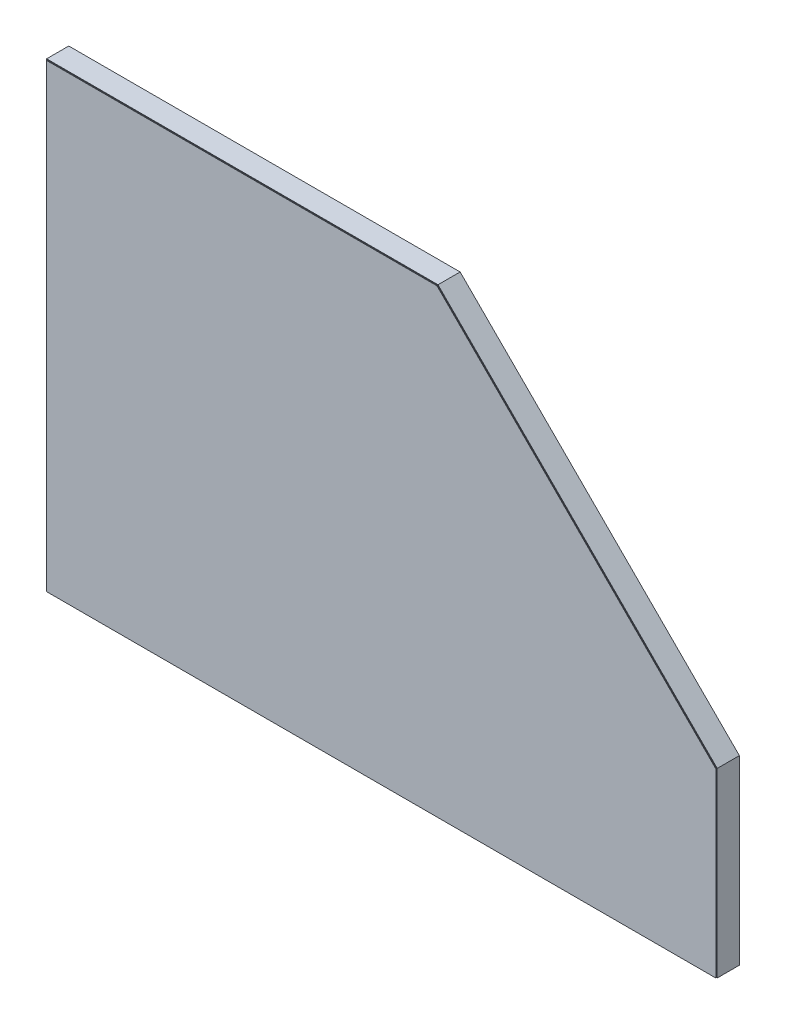
from build123d import *

# Parameters (mm, degrees)
SALIENTE_EXTRUIR1_DEPTH = 0.83566
SALIENTE_EXTRUIR2_DEPTH = 25.4


with BuildPart() as part:
    # Croquis1 → Saliente-Extruir1 (new body)
    with BuildSketch(Plane.XY):
        Polygon((0, 0), (768, 0), (768, 208), (448, 528), (0, 528), align=None)
    extrude(amount=SALIENTE_EXTRUIR1_DEPTH)


with BuildPart() as body_2:
    # Croquis3 → Saliente-Extruir2 (new body)
    with BuildSketch(Plane(origin=(0, 0, 0), x_dir=(-1, 0, 0), z_dir=(0, 0, -1))):
        Polygon((0.83566, 0), (0.83566, 528.83566), (-448.346141706, 528.83566), (-768.83566, 208.346141706), (-768.83566, 0), (-768, 0), (-768, 208), (-448, 528), (0, 528), (0, 0), align=None)
    extrude(amount=SALIENTE_EXTRUIR2_DEPTH)


solid = Compound([part.part, body_2.part])
